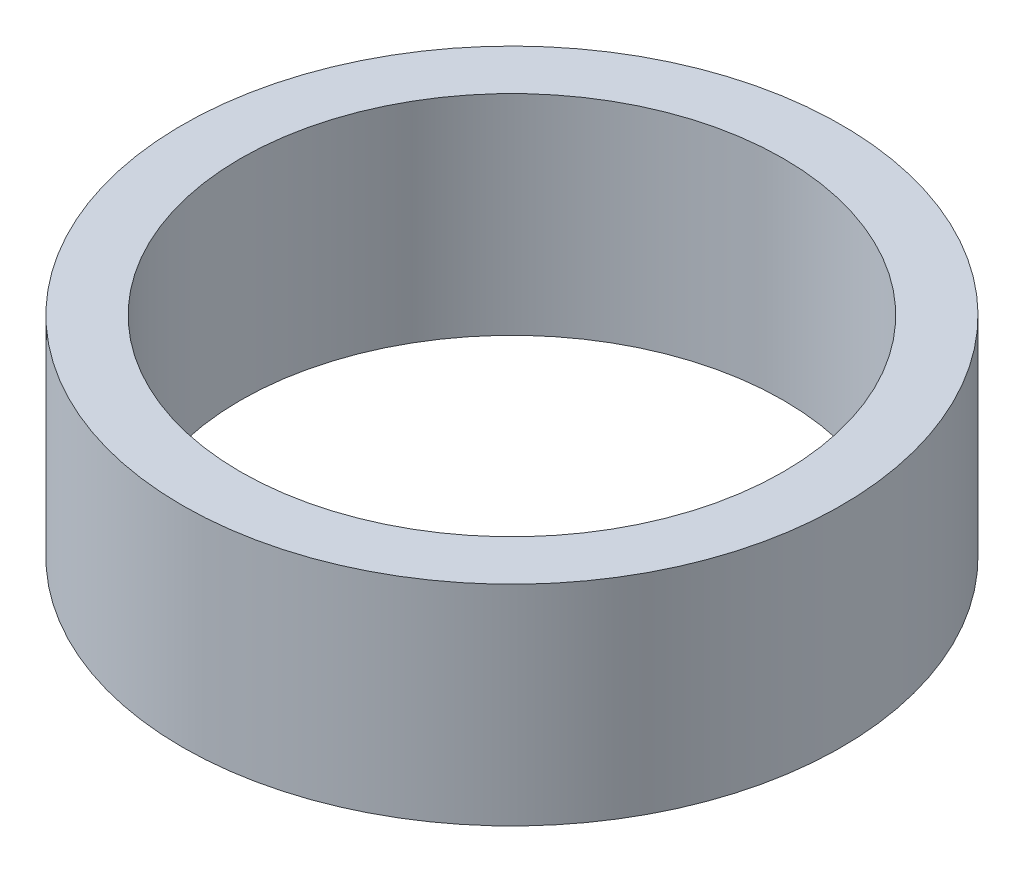
from build123d import *

# Parameters (mm, degrees)
SKETCH1_R           = 42.5
BOSS_EXTRUDE1_DEPTH = 27
SKETCH2_R           = 35
CUT_EXTRUDE1_DEPTH  = 66.890059948


with BuildPart() as part:
    # Sketch1 → Boss-Extrude1 (new body)
    with BuildSketch(Plane(origin=(0, 0, 0), x_dir=(1, 0, 0), z_dir=(0, 1, 0))):
        Circle(SKETCH1_R)
    extrude(amount=BOSS_EXTRUDE1_DEPTH)

    # Sketch2 → Cut-Extrude1 (cut, through all)
    with BuildSketch(Plane(origin=(0, 0, 0), x_dir=(1, 0, 0), z_dir=(0, 1, 0))):
        Circle(SKETCH2_R)
    extrude(amount=CUT_EXTRUDE1_DEPTH, mode=Mode.SUBTRACT)


solid = part.part
